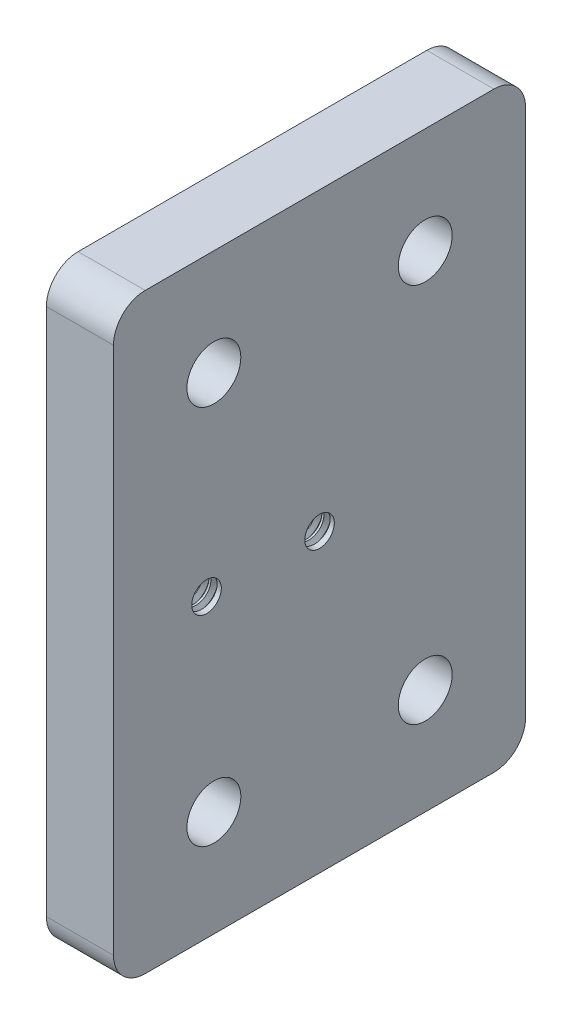
from build123d import *

# Parameters (mm, degrees)
BOSS_EXTRUDE1_DEPTH      = 3.175
BOSS_EXTRUDE1_DEPTH_BACK = 3.175
SKETCH1_W                = 39
SKETCH1_H                = 56
SKETCH1_R                = 2.55
SKETCH1_R_2              = 1.397
THREAD1_PITCH            = 0.79375
THREAD2_PITCH            = 0.79375
FILLET1_R                = 3


with BuildPart() as part:
    # Sketch1 → Boss-Extrude1 (new, two sides: drawn at the far end of the back side and taken through both)
    with BuildSketch(Plane(origin=(0, 0, 0), x_dir=(0, 0, -1), z_dir=(1, 0, 0)).offset(-BOSS_EXTRUDE1_DEPTH_BACK)):
        Rectangle(SKETCH1_W, SKETCH1_H)
        with Locations((-10, 18)):
            Circle(SKETCH1_R, mode=Mode.SUBTRACT)
        with Locations(Location((10, 18, 0), (0, 0, 180))):
            Circle(SKETCH1_R, mode=Mode.SUBTRACT)
        with Locations((10, -18)):
            Circle(SKETCH1_R, mode=Mode.SUBTRACT)
        with Locations(Location((-10, -18, 0), (0, 0, 180))):
            Circle(SKETCH1_R, mode=Mode.SUBTRACT)
        with Locations((-10.6934, 0)):
            Circle(SKETCH1_R_2, mode=Mode.SUBTRACT)
        Circle(SKETCH1_R_2, mode=Mode.SUBTRACT)
    extrude(amount=BOSS_EXTRUDE1_DEPTH + BOSS_EXTRUDE1_DEPTH_BACK)

    # Thread1: the profile of Thread Profile1 profile screwed along a right-hand helix of 12.598425 turns, 8 arcs to a turn; built about Z, then put on its axis
    thread1_z = Axis((0, 0, 0), (0, 0, 1))
    thread1_corners = [(1.3967, 0, -0.000173205), (1.826629788, 0, 0.248046874), (1.826629788, 0, 0.347265624), (1.3967, 0, 0.595485703)]
    with BuildLine(mode=Mode.PRIVATE) as thread1_profile:
        Line(thread1_corners[0], thread1_corners[1])
        Line(thread1_corners[1], thread1_corners[2])
        Line(thread1_corners[2], thread1_corners[3])
        Line(thread1_corners[3], thread1_corners[0])
    thread1_cap = Face(thread1_profile.wire())
    thread1_turn_angles = [0, 22.5, 45, 67.5, 90, 112.5, 135, 157.5, 180, 202.5, 225, 247.5, 270, 292.5, 315, 337.5, 360]
    thread1_turn_weights = [1, 0.9238795325112867, 1, 0.9238795325112867, 1, 0.9238795325112867, 1, 0.9238795325112867, 1, 0.9238795325112867, 1, 0.9238795325112867, 1, 0.9238795325112867, 1, 0.9238795325112867, 1]
    thread1_turn_rails = [Edge.make_bspline([Vector(p[0], p[1], 0).rotate(thread1_z, thread1_turn_angles[k]) / thread1_turn_weights[k] + Vector(0, 0, p[2] + THREAD1_PITCH * thread1_turn_angles[k] / 360) for k in range(17)], [0, 0, 0, 1, 1, 2, 2, 3, 3, 4, 4, 5, 5, 6, 6, 7, 7, 8, 8, 8], 2, thread1_turn_weights) for p in thread1_corners]
    thread1_turn_sides = [Face.make_surface_from_curves(thread1_turn_rails[p[0]], thread1_turn_rails[p[1]]) for p in [(0, 1), (1, 2), (2, 3), (3, 0)]]
    thread1_last_angles = [4320, 4342.5, 4365, 4387.5, 4410, 4432.5, 4455, 4477.5, 4500, 4517.716535433, 4535.433070866]
    thread1_last_weights = [1, 0.9238795325112867, 1, 0.9238795325112867, 1, 0.9238795325112867, 1, 0.9238795325112867, 1, 0.9525736983244454, 1]
    thread1_last_rails = [Edge.make_bspline([Vector(p[0], p[1], 0).rotate(thread1_z, thread1_last_angles[k]) / thread1_last_weights[k] + Vector(0, 0, p[2] + THREAD1_PITCH * thread1_last_angles[k] / 360) for k in range(11)], [0, 0, 0, 1, 1, 2, 2, 3, 3, 4, 4, 5, 5, 5], 2, thread1_last_weights) for p in thread1_corners]
    thread1_last_sides = [Face.make_surface_from_curves(thread1_last_rails[p[0]], thread1_last_rails[p[1]]) for p in [(0, 1), (1, 2), (2, 3), (3, 0)]]
    thread1 = Plane(origin=(3.175, 0, 10.6934), x_dir=(0, 0, 1), z_dir=(-1, 0, 0)) * Solid(Shell([*[p.moved(Location((0, 0, THREAD1_PITCH * i))) for i in range(12) for p in thread1_turn_sides], *thread1_last_sides, thread1_cap, thread1_cap.rotate(thread1_z, 4535.433070866).moved(Location((0, 0, THREAD1_PITCH * 4535.433070866 / 360)))]))
    add(thread1, mode=Mode.SUBTRACT)

    # Thread2: the profile of Thread Profile2 profile screwed along a right-hand helix of 12.598425 turns, 8 arcs to a turn; built about Z, then put on its axis
    thread2_z = Axis((0, 0, 0), (0, 0, 1))
    thread2_corners = [(1.3967, 0, -0.000173205), (1.826629788, 0, 0.248046874), (1.826629788, 0, 0.347265624), (1.3967, 0, 0.595485703)]
    with BuildLine(mode=Mode.PRIVATE) as thread2_profile:
        Line(thread2_corners[0], thread2_corners[1])
        Line(thread2_corners[1], thread2_corners[2])
        Line(thread2_corners[2], thread2_corners[3])
        Line(thread2_corners[3], thread2_corners[0])
    thread2_cap = Face(thread2_profile.wire())
    thread2_turn_angles = [0, 22.5, 45, 67.5, 90, 112.5, 135, 157.5, 180, 202.5, 225, 247.5, 270, 292.5, 315, 337.5, 360]
    thread2_turn_weights = [1, 0.9238795325112867, 1, 0.9238795325112867, 1, 0.9238795325112867, 1, 0.9238795325112867, 1, 0.9238795325112867, 1, 0.9238795325112867, 1, 0.9238795325112867, 1, 0.9238795325112867, 1]
    thread2_turn_rails = [Edge.make_bspline([Vector(p[0], p[1], 0).rotate(thread2_z, thread2_turn_angles[k]) / thread2_turn_weights[k] + Vector(0, 0, p[2] + THREAD2_PITCH * thread2_turn_angles[k] / 360) for k in range(17)], [0, 0, 0, 1, 1, 2, 2, 3, 3, 4, 4, 5, 5, 6, 6, 7, 7, 8, 8, 8], 2, thread2_turn_weights) for p in thread2_corners]
    thread2_turn_sides = [Face.make_surface_from_curves(thread2_turn_rails[p[0]], thread2_turn_rails[p[1]]) for p in [(0, 1), (1, 2), (2, 3), (3, 0)]]
    thread2_last_angles = [4320, 4342.5, 4365, 4387.5, 4410, 4432.5, 4455, 4477.5, 4500, 4517.716535433, 4535.433070866]
    thread2_last_weights = [1, 0.9238795325112867, 1, 0.9238795325112867, 1, 0.9238795325112867, 1, 0.9238795325112867, 1, 0.9525736983244454, 1]
    thread2_last_rails = [Edge.make_bspline([Vector(p[0], p[1], 0).rotate(thread2_z, thread2_last_angles[k]) / thread2_last_weights[k] + Vector(0, 0, p[2] + THREAD2_PITCH * thread2_last_angles[k] / 360) for k in range(11)], [0, 0, 0, 1, 1, 2, 2, 3, 3, 4, 4, 5, 5, 5], 2, thread2_last_weights) for p in thread2_corners]
    thread2_last_sides = [Face.make_surface_from_curves(thread2_last_rails[p[0]], thread2_last_rails[p[1]]) for p in [(0, 1), (1, 2), (2, 3), (3, 0)]]
    thread2 = Plane(origin=(3.175, 0, 0), x_dir=(0, 0, 1), z_dir=(-1, 0, 0)) * Solid(Shell([*[p.moved(Location((0, 0, THREAD2_PITCH * i))) for i in range(12) for p in thread2_turn_sides], *thread2_last_sides, thread2_cap, thread2_cap.rotate(thread2_z, 4535.433070866).moved(Location((0, 0, THREAD2_PITCH * 4535.433070866 / 360)))]))
    add(thread2, mode=Mode.SUBTRACT)

    # Fillet1
    fillet1_edges = [part.edges().sort_by_distance(p)[0] for p in [
        (0, 28, 19.5),
        (0, 28, -19.5),
        (0, -28, -19.5),
        (0, -28, 19.5),
    ]]
    fillet(fillet1_edges, radius=FILLET1_R)


solid = part.part
